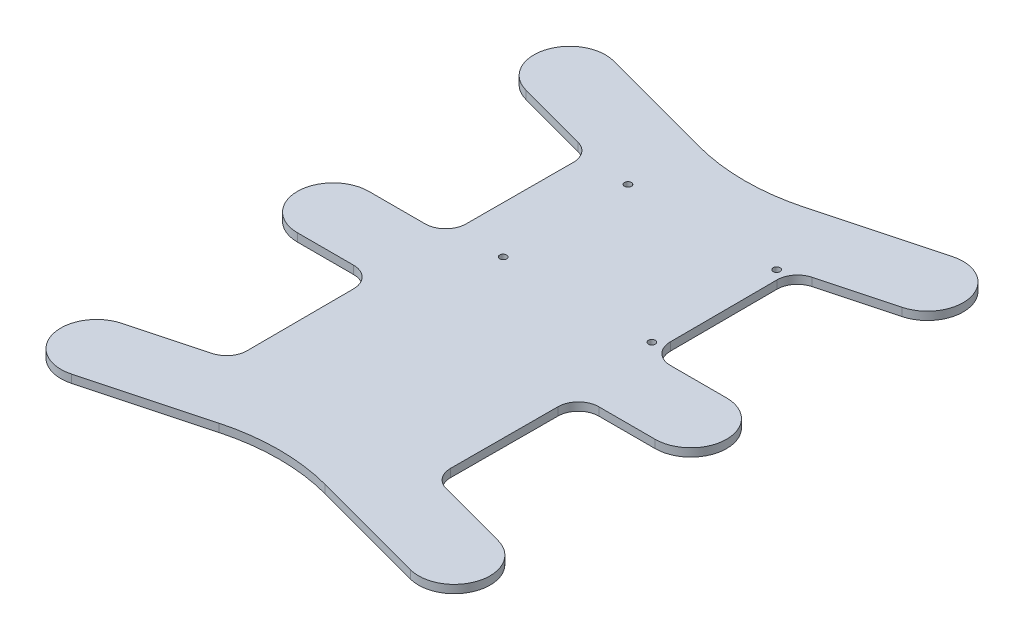
from build123d import *

# Parameters (mm, degrees)
BOSS_EXTRUDE1_DEPTH     = 3.175
FILLET1_R               = 80
FILLET2_R               = 8
CUT_EXTRUDE1_DEPTH      = 136.741386774
CUT_EXTRUDE1_DEPTH_BACK = 136.741386774
SKETCH2_R               = 1.35


with BuildPart() as part:
    # Sketch1 → Boss-Extrude1 (new body)
    with BuildSketch(Plane(origin=(0, 0, 0), x_dir=(1, 0, 0), z_dir=(0, 1, 0))):
        with BuildLine():
            Line((-70, 14), (-40, 14))
            Line((-40, 14), (-39.816062711, 70))
            Line((-39.816062711, 70), (-73.623466631, 79.058666579))
            ThreePointArc((-73.623466631, 79.058666579), (-83.522961568, 96.205094778), (-66.376533369, 106.104589715))
            Line((-66.376533369, 106.104589715), (0, 88.319051202))
            Line((0, 88.319051202), (66.376533369, 106.104589715))
            ThreePointArc((66.376533369, 106.104589715), (83.522961568, 96.205094778), (73.623466631, 79.058666579))
            Line((73.623466631, 79.058666579), (39.816062711, 70))
            Line((39.816062711, 70), (40, 14))
            Line((40, 14), (70, 14))
            ThreePointArc((70, 14), (84, 0), (70, -14))
            Line((70, -14), (40, -14))
            Line((40, -14), (39.816062711, -70))
            Line((39.816062711, -70), (73.623466631, -79.058666579))
            ThreePointArc((73.623466631, -79.058666579), (83.522961568, -96.205094778), (66.376533369, -106.104589715))
            Line((66.376533369, -106.104589715), (0, -88.319051202))
            Line((0, -88.319051202), (-66.376533369, -106.104589715))
            ThreePointArc((-66.376533369, -106.104589715), (-83.522961568, -96.205094778), (-73.623466631, -79.058666579))
            Line((-73.623466631, -79.058666579), (-39.816062711, -70))
            Line((-39.816062711, -70), (-40, -14))
            Line((-40, -14), (-70, -14))
            ThreePointArc((-70, -14), (-84, 0), (-70, 14))
        make_face()
    extrude(amount=BOSS_EXTRUDE1_DEPTH)

    # Fillet1
    fillet1_edges = [part.edges().sort_by_distance(p)[0] for p in [
        (0, 1.5875, -88.319051202),
        (0, 1.5875, 88.319051202),
    ]]
    fillet(fillet1_edges, radius=FILLET1_R)

    # Fillet2
    fillet2_edges = [part.edges().sort_by_distance(p)[0] for p in [
        (39.816062711, 1.5875, 70),
        (40, 1.5875, 14),
        (40, 1.5875, -14),
        (39.816062711, 1.5875, -70),
        (-39.816062711, 1.5875, -70),
        (-40, 1.5875, -14),
        (-40, 1.5875, 14),
        (-39.816062711, 1.5875, 70),
    ]]
    fillet(fillet2_edges, radius=FILLET2_R)

    # Sketch2 → Cut-Extrude1 (cut, two sides: drawn at the far end of the back side and taken through both)
    with BuildSketch(Plane(origin=(0, 3.175, 0), x_dir=(1, 0, 0), z_dir=(0, 1, 0)).offset(-CUT_EXTRUDE1_DEPTH_BACK)):
        with Locations((36.325077299, 67.24974642)):
            Circle(SKETCH2_R)
        with Locations((36.486021558, 18.250010738)):
            Circle(SKETCH2_R)
        with Locations((-21.513665576, 18.059505288)):
            Circle(SKETCH2_R)
        with Locations((-21.674609835, 67.05924097)):
            Circle(SKETCH2_R)
    extrude(amount=CUT_EXTRUDE1_DEPTH + CUT_EXTRUDE1_DEPTH_BACK, mode=Mode.SUBTRACT)


solid = part.part
